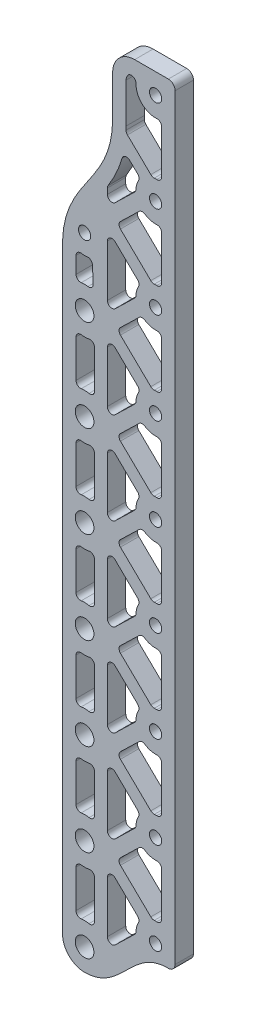
from build123d import *

# Parameters (mm, degrees)
SKETCH2_R                 = 1.625
SKETCH2_R_2               = 1.1
BOSS_EXTRUDE2_DEPTH       = 3
FILLET2_R                 = 3.5
CUT_EXTRUDE5_DEPTH        = 96.681621426
CUT_EXTRUDE5_DEPTH_BACK   = 96.681621426
FILLET7_R                 = 0.75
FILLET8_R                 = 1
FILLET9_R                 = 1
FILLET10_R                = 1
CUT_EXTRUDE8_DEPTH        = 96.681621426
BOSS_EXTRUDE3_START       = -3
BOSS_EXTRUDE3_OUTLINE_R   = 1.1
BOSS_EXTRUDE3_OUTLINE_R_2 = 1
BOSS_EXTRUDE3_OUTLINE_R_3 = 1.625
BOSS_EXTRUDE3_OUTLINE_R_4 = 1.525
BOSS_EXTRUDE3_DEPTH       = 3


# Read off the part's stored shape, not the designer's step: Boss-Extrude3
# Some blends are built 0.0001 mm under size
with BuildPart() as part:
    # Sketch2 → Boss-Extrude2 (new body)
    with BuildSketch(Plane.XY):
        with BuildLine():
            Line((-3.5, 62.5), (-3.5, -38.5))
            Line((-3.5, -38.5), (0, -38.5))
            add(Edge.make_bspline(
                [(0, -38.5), (6, -38.5), (7.5625, -31.1), (13.5625, -31.1)],
                knots=[0, 0, 0, 0, 1, 1, 1, 1], degree=3))
            Line((13.5625, -31.1), (14.125, -31.1))
            Line((14.125, -31.1), (14.125, -31.099203673))
            Line((14.125, -31.099203673), (14.6875, -31.099203673))
            Line((14.6875, -31.099203673), (14.6875, 94.5))
            Line((14.6875, 94.5), (4.6875, 94.5))
            Line((4.6875, 94.5), (4.6875, 84.5))
            add(Edge.make_bspline(
                [(-3.5, 62.5), (-3.5, 72.5), (4.6875, 74.5), (4.6875, 84.5)],
                knots=[0, 0, 0, 0, 1, 1, 1, 1], degree=3))
        make_face()
        with Locations((0, -35)):
            Circle(SKETCH2_R, mode=Mode.SUBTRACT)
        with Locations((0, -20)):
            Circle(SKETCH2_R, mode=Mode.SUBTRACT)
        with Locations((0, -5)):
            Circle(SKETCH2_R, mode=Mode.SUBTRACT)
        with Locations((0, 10)):
            Circle(SKETCH2_R, mode=Mode.SUBTRACT)
        with Locations((0, 25)):
            Circle(SKETCH2_R, mode=Mode.SUBTRACT)
        with Locations((11.6, -28.75)):
            Circle(SKETCH2_R_2, mode=Mode.SUBTRACT)
        with Locations((11.6, -13.75)):
            Circle(SKETCH2_R_2, mode=Mode.SUBTRACT)
        with Locations((11.6, 1.25)):
            Circle(SKETCH2_R_2, mode=Mode.SUBTRACT)
        with Locations((11.6, 16.25)):
            Circle(SKETCH2_R_2, mode=Mode.SUBTRACT)
        with Locations((0, 40)):
            Circle(SKETCH2_R, mode=Mode.SUBTRACT)
        with Locations((0, 55)):
            Circle(SKETCH2_R, mode=Mode.SUBTRACT)
        with Locations((0, 66)):
            Circle(SKETCH2_R_2, mode=Mode.SUBTRACT)
        with Locations((11.6, 31.25)):
            Circle(SKETCH2_R_2, mode=Mode.SUBTRACT)
        with Locations((11.6, 46.25)):
            Circle(SKETCH2_R_2, mode=Mode.SUBTRACT)
        with Locations((11.6, 61.25)):
            Circle(SKETCH2_R_2, mode=Mode.SUBTRACT)
        with Locations((11.6, 76.25)):
            Circle(SKETCH2_R_2, mode=Mode.SUBTRACT)
        with Locations((11.6, 91.25)):
            Circle(SKETCH2_R_2, mode=Mode.SUBTRACT)
    extrude(amount=BOSS_EXTRUDE2_DEPTH)

    # Fillet2
    fillet2_edges = [part.edges().sort_by_distance(p)[0] for p in [
        (4.6875, 94.5, 1.5),
        (-3.5, -38.5, 1.5),
    ]]
    fillet(fillet2_edges, radius=FILLET2_R - 0.0001)  # a hair under: the kernel refuses the full size

    # Sketch11 → Cut-Extrude5 (cut, two sides: drawn at the far end of the back side and taken through both)
    with BuildSketch(Plane.XY.offset(3).offset(-CUT_EXTRUDE5_DEPTH_BACK)):
        with BuildLine():
            Line((3.725, -33.468053879), (8.405154507, -28.931555164))
            ThreePointArc((8.405154507, -28.931555164), (8.552405464, -27.774209272), (9.104752078, -26.746568491))
            Line((9.104752078, -26.746568491), (3.725, -21.531946121))
            Line((3.725, -21.531946121), (3.725, -33.468053879))
        make_face()
        with BuildLine():
            ThreePointArc((11.075803274, -25.59322668), (11.838436702, -25.558895499), (12.5875, -25.706179416))
            Line((12.5875, -25.706179416), (12.5875, -16.793820584))
            ThreePointArc((12.5875, -16.793820584), (10.87997204, -16.867941586), (9.377845109, -16.05261322))
            Line((9.377845109, -16.05261322), (5.305457748, -20))
            Line((5.305457748, -20), (11.075803274, -25.59322668))
        make_face()
        with BuildLine():
            Line((-1.4, -23.45190165), (-1.4, -31.54809835))
            ThreePointArc((-1.4, -31.54809835), (0.123118135, -31.277035197), (1.625, -31.648134848))
            Line((1.625, -31.648134848), (1.625, -23.351865152))
            ThreePointArc((1.625, -23.351865152), (0.123118135, -23.722964803), (-1.4, -23.45190165))
        make_face()
        with BuildLine():
            Line((3.725, -18.468053879), (8.405154507, -13.931555164))
            ThreePointArc((8.405154507, -13.931555164), (8.552405464, -12.774209272), (9.104752078, -11.746568491))
            Line((9.104752078, -11.746568491), (3.725, -6.531946121))
            Line((3.725, -6.531946121), (3.725, -18.468053879))
        make_face()
        with BuildLine():
            Line((-1.4, -8.45190165), (-1.4, -16.54809835))
            ThreePointArc((-1.4, -16.54809835), (0.123118135, -16.277035197), (1.625, -16.648134848))
            Line((1.625, -16.648134848), (1.625, -8.351865152))
            ThreePointArc((1.625, -8.351865152), (0.123118135, -8.722964803), (-1.4, -8.45190165))
        make_face()
        with BuildLine():
            ThreePointArc((11.075803274, -10.59322668), (11.838436702, -10.558895499), (12.5875, -10.706179416))
            Line((12.5875, -10.706179416), (12.5875, -1.793820584))
            ThreePointArc((12.5875, -1.793820584), (10.87997204, -1.867941586), (9.377845109, -1.05261322))
            Line((9.377845109, -1.05261322), (5.305457748, -5))
            Line((5.305457748, -5), (11.075803274, -10.59322668))
        make_face()
        with BuildLine():
            Line((-1.4, 6.54809835), (-1.4, -1.54809835))
            ThreePointArc((-1.4, -1.54809835), (0.123118135, -1.277035197), (1.625, -1.648134848))
            Line((1.625, -1.648134848), (1.625, 6.648134848))
            ThreePointArc((1.625, 6.648134848), (0.123118135, 6.277035197), (-1.4, 6.54809835))
        make_face()
        with BuildLine():
            ThreePointArc((11.075803274, 4.40677332), (11.838436702, 4.441104501), (12.5875, 4.293820584))
            Line((12.5875, 4.293820584), (12.5875, 13.206179416))
            ThreePointArc((12.5875, 13.206179416), (10.87997204, 13.132058414), (9.377845109, 13.94738678))
            Line((9.377845109, 13.94738678), (5.305457748, 10))
            Line((5.305457748, 10), (11.075803274, 4.40677332))
        make_face()
        with BuildLine():
            Line((3.725, 8.468053879), (3.725, -3.468053879))
            Line((3.725, -3.468053879), (8.405154507, 1.068444836))
            ThreePointArc((8.405154507, 1.068444836), (8.552405464, 2.225790728), (9.104752078, 3.253431509))
            Line((9.104752078, 3.253431509), (3.725, 8.468053879))
        make_face()
        with BuildLine():
            Line((-1.4, 21.54809835), (-1.4, 13.45190165))
            ThreePointArc((-1.4, 13.45190165), (0.123118135, 13.722964803), (1.625, 13.351865152))
            Line((1.625, 13.351865152), (1.625, 21.648134848))
            ThreePointArc((1.625, 21.648134848), (0.123118135, 21.277035197), (-1.4, 21.54809835))
        make_face()
        with BuildLine():
            ThreePointArc((11.075803274, 19.40677332), (11.838436702, 19.441104501), (12.5875, 19.293820584))
            Line((12.5875, 19.293820584), (12.5875, 28.206179416))
            ThreePointArc((12.5875, 28.206179416), (10.87997204, 28.132058414), (9.377845109, 28.94738678))
            Line((9.377845109, 28.94738678), (5.305457748, 25))
            Line((5.305457748, 25), (11.075803274, 19.40677332))
        make_face()
        with BuildLine():
            Line((3.725, 11.531946121), (8.405154507, 16.068444836))
            ThreePointArc((8.405154507, 16.068444836), (8.552405464, 17.225790728), (9.104752078, 18.253431509))
            Line((9.104752078, 18.253431509), (3.725, 23.468053879))
            Line((3.725, 23.468053879), (3.725, 11.531946121))
        make_face()
        with BuildLine():
            Line((-1.4, 36.54809835), (-1.4, 28.45190165))
            ThreePointArc((-1.4, 28.45190165), (0.123118135, 28.722964803), (1.625, 28.351865152))
            Line((1.625, 28.351865152), (1.625, 36.648134848))
            ThreePointArc((1.625, 36.648134848), (0.123118135, 36.277035197), (-1.4, 36.54809835))
        make_face()
        with BuildLine():
            ThreePointArc((11.075803274, 34.40677332), (11.838436702, 34.441104501), (12.5875, 34.293820584))
            Line((12.5875, 34.293820584), (12.5875, 43.206179416))
            ThreePointArc((12.5875, 43.206179416), (10.87997204, 43.132058414), (9.377845109, 43.94738678))
            Line((9.377845109, 43.94738678), (5.305457748, 40))
            Line((5.305457748, 40), (11.075803274, 34.40677332))
        make_face()
        with BuildLine():
            Line((3.725, 26.531946121), (8.405154507, 31.068444836))
            ThreePointArc((8.405154507, 31.068444836), (8.552405464, 32.225790728), (9.104752078, 33.253431509))
            Line((9.104752078, 33.253431509), (3.725, 38.468053879))
            Line((3.725, 38.468053879), (3.725, 26.531946121))
        make_face()
        with BuildLine():
            Line((-1.4, 51.54809835), (-1.4, 43.45190165))
            ThreePointArc((-1.4, 43.45190165), (0.123118135, 43.722964803), (1.625, 43.351865152))
            Line((1.625, 43.351865152), (1.625, 51.648134848))
            ThreePointArc((1.625, 51.648134848), (0.123118135, 51.277035197), (-1.4, 51.54809835))
        make_face()
        with BuildLine():
            ThreePointArc((11.075803274, 49.40677332), (11.838436702, 49.441104501), (12.5875, 49.293820584))
            Line((12.5875, 49.293820584), (12.5875, 58.206179416))
            ThreePointArc((12.5875, 58.206179416), (10.87997204, 58.132058414), (9.377845109, 58.94738678))
            Line((9.377845109, 58.94738678), (5.305457748, 55))
            Line((5.305457748, 55), (11.075803274, 49.40677332))
        make_face()
        with BuildLine():
            Line((3.725, 41.531946121), (8.405154507, 46.068444836))
            ThreePointArc((8.405154507, 46.068444836), (8.552405464, 47.225790728), (9.104752078, 48.253431509))
            Line((9.104752078, 48.253431509), (3.725, 53.468053879))
            Line((3.725, 53.468053879), (3.725, 41.531946121))
        make_face()
        with BuildLine():
            Line((-1.4, 62.5), (-1.4, 58.45190165))
            ThreePointArc((-1.4, 58.45190165), (0.034214253, 58.724842867), (1.463172775, 58.4256022))
            Line((1.463172775, 58.4256022), (1.242166701, 63.05092864))
            ThreePointArc((1.242166701, 63.05092864), (-0.079937947, 62.800998605), (-1.387909616, 63.116650056))
            add(Edge.make_bspline(
                [(-1.387909616, 63.116650056), (-1.395884035, 62.912888667), (-1.4, 62.704817034), (-1.4, 62.5)],
                knots=[0.976163712, 0.976163712, 0.976163712, 0.976163712, 1, 1, 1, 1], degree=3))
        make_face()
        with BuildLine():
            ThreePointArc((11.075803274, 64.40677332), (11.838436702, 64.441104501), (12.5875, 64.293820584))
            Line((12.5875, 64.293820584), (12.5875, 73.206179416))
            ThreePointArc((12.5875, 73.206179416), (10.87997204, 73.132058414), (9.377845109, 73.94738678))
            Line((9.377845109, 73.94738678), (5.305457748, 70))
            Line((5.305457748, 70), (11.075803274, 64.40677332))
        make_face()
        with BuildLine():
            Line((3.725, 56.531946121), (8.405154507, 61.068444836))
            ThreePointArc((8.405154507, 61.068444836), (8.552405464, 62.225790728), (9.104752078, 63.253431509))
            Line((9.104752078, 63.253431509), (3.725, 68.468053879))
            Line((3.725, 68.468053879), (3.725, 56.531946121))
        make_face()
        with BuildLine():
            ThreePointArc((11.075803274, 79.40677332), (11.838436702, 79.441104501), (12.5875, 79.293820584))
            Line((12.5875, 79.293820584), (12.5875, 88.206179416))
            ThreePointArc((12.5875, 88.206179416), (9.277124298, 89.04903465), (8.613781656, 92.4))
            Line((8.613781656, 92.4), (8.1875, 92.4))
            ThreePointArc((8.1875, 92.4), (7.197550506, 91.989949494), (6.7875, 91))
            Line((6.7875, 91), (6.7875, 84.5))
            add(Edge.make_bspline(
                [(6.7875, 84.5), (6.7875, 84.194951753), (6.780380262, 83.886036866), (6.766439869, 83.583862242)],
                knots=[0, 0, 0, 0, 0.027924099, 0.027924099, 0.027924099, 0.027924099], degree=3))
            Line((6.766439869, 83.583862242), (11.075803274, 79.40677332))
        make_face()
        with BuildLine():
            Line((3.725, 71.531946121), (8.405154507, 76.068444836))
            ThreePointArc((8.405154507, 76.068444836), (8.552405464, 77.225790728), (9.104752078, 78.253431509))
            Line((9.104752078, 78.253431509), (6.429638417, 80.846433442))
            add(Edge.make_bspline(
                [(6.429638417, 80.846433442), (6.416072101, 80.780043671), (6.27732761, 80.121430007), (5.948536697, 78.931514317), (5.147093837, 76.868639651), (4.349164485, 75.426872946), (3.778979133, 74.508236606), (3.725, 74.422123209)],
                knots=[0.118031375, 0.118031375, 0.118031375, 0.118031375, 0.125, 0.1875, 0.25, 0.375, 0.388032458, 0.388032458, 0.388032458, 0.388032458], degree=3))
            Line((3.725, 74.422123209), (3.725, 71.531946121))
        make_face()
    extrude(amount=CUT_EXTRUDE5_DEPTH + CUT_EXTRUDE5_DEPTH_BACK, mode=Mode.SUBTRACT)

    # Fillet7
    fillet7_edges = [part.edges().sort_by_distance(p)[0] for p in [
        (12.5875, -1.793820584, 1.5),
        (12.5875, 4.293820584, 1.5),
        (12.5875, -10.706179416, 1.5),
        (12.5875, -16.793820584, 1.5),
        (11.075803274, -10.59322668, 1.5),
        (5.305457748, -5, 1.5),
        (9.377845109, -1.05261322, 1.5),
        (8.405154507, 1.068444836, 1.5),
        (3.725, -3.468053879, 1.5),
        (3.725, 8.468053879, 1.5),
        (9.104752078, 3.253431509, 1.5),
        (1.242166701, 63.05092864, 1.5),
        (1.463172775, 58.4256022, 1.5),
        (-1.4, 58.45190165, 1.5),
        (-1.4, 51.54809835, 1.5),
        (-1.387909616, 63.116650056, 1.5),
        (12.5875, 58.206179416, 1.5),
        (12.5875, 64.293820584, 1.5),
        (12.5875, 49.293820584, 1.5),
        (12.5875, 43.206179416, 1.5),
        (11.075803274, 49.40677332, 1.5),
        (5.305457748, 55, 1.5),
        (9.377845109, 58.94738678, 1.5),
        (8.405154507, 31.068444836, 1.5),
        (3.725, 26.531946121, 1.5),
        (3.725, 38.468053879, 1.5),
        (9.104752078, 33.253431509, 1.5),
        (-1.4, 36.54809835, 1.5),
        (-1.4, 43.45190165, 1.5),
        (1.625, 51.648134848, 1.5),
        (1.625, 36.648134848, 1.5),
        (1.625, 43.351865152, 1.5),
        (8.405154507, 16.068444836, 1.5),
        (3.725, 11.531946121, 1.5),
        (3.725, 23.468053879, 1.5),
        (9.104752078, 18.253431509, 1.5),
        (-1.4, 6.54809835, 1.5),
        (-1.4, 13.45190165, 1.5),
        (-1.4, 28.45190165, 1.5),
        (-1.4, 21.54809835, 1.5),
        (1.625, 28.351865152, 1.5),
        (1.625, 21.648134848, 1.5),
        (1.625, 6.648134848, 1.5),
        (1.625, 13.351865152, 1.5),
        (-1.4, -31.54809835, 1.5),
        (-1.4, -16.54809835, 1.5),
        (-1.4, -23.45190165, 1.5),
        (9.104752078, 78.253431509, 1.5),
        (8.405154507, 76.068444836, 1.5),
        (3.725, 71.531946121, 1.5),
        (3.725, 74.422123209, 1.5),
        (6.429638417, 80.846433442, 1.5),
        (12.5875, -25.706179416, 1.5),
        (11.075803274, -25.59322668, 1.5),
        (5.305457748, -20, 1.5),
        (9.377845109, -16.05261322, 1.5),
        (8.405154507, 46.068444836, 1.5),
        (3.725, 41.531946121, 1.5),
        (3.725, 53.468053879, 1.5),
        (9.104752078, 48.253431509, 1.5),
        (8.613781656, 92.4, 1.5),
        (12.5875, 88.206179416, 1.5),
        (12.5875, 73.206179416, 1.5),
        (12.5875, 79.293820584, 1.5),
        (11.075803274, 79.40677332, 1.5),
        (6.766439869, 83.583862242, 1.5),
        (11.075803274, 64.40677332, 1.5),
        (5.305457748, 70, 1.5),
        (9.377845109, 73.94738678, 1.5),
        (8.405154507, -28.931555164, 1.5),
        (3.725, -33.468053879, 1.5),
        (3.725, -21.531946121, 1.5),
        (9.104752078, -26.746568491, 1.5),
        (12.5875, 34.293820584, 1.5),
        (12.5875, 28.206179416, 1.5),
        (12.5875, 13.206179416, 1.5),
        (12.5875, 19.293820584, 1.5),
        (11.075803274, 19.40677332, 1.5),
        (5.305457748, 25, 1.5),
        (9.377845109, 28.94738678, 1.5),
        (11.075803274, 4.40677332, 1.5),
        (5.305457748, 10, 1.5),
        (9.377845109, 13.94738678, 1.5),
        (11.075803274, 34.40677332, 1.5),
        (5.305457748, 40, 1.5),
        (9.377845109, 43.94738678, 1.5),
        (-1.4, -1.54809835, 1.5),
        (-1.4, -8.45190165, 1.5),
        (1.625, -1.648134848, 1.5),
        (1.625, -8.351865152, 1.5),
        (1.625, -16.648134848, 1.5),
        (1.625, -23.351865152, 1.5),
        (8.405154507, 61.068444836, 1.5),
        (3.725, 56.531946121, 1.5),
        (3.725, 68.468053879, 1.5),
        (9.104752078, 63.253431509, 1.5),
        (8.405154507, -13.931555164, 1.5),
        (3.725, -18.468053879, 1.5),
        (3.725, -6.531946121, 1.5),
        (9.104752078, -11.746568491, 1.5),
        (1.625, -31.648134848, 1.5),
    ]]
    fillet(fillet7_edges, radius=FILLET7_R)

    # Fillet8
    fillet8_edges = [part.edges().sort_by_distance(p)[0] for p in [
        (14.6875, 94.5, 1.5),
    ]]
    fillet(fillet8_edges, radius=FILLET8_R)

    # Fillet9
    # the kernel refuses this fillet: 1 mm, written as the material it takes off along each edge
    with BuildSketch(Plane(origin=(14.6875, -31.099203673, -2.248046027), x_dir=(0, 1, 0), z_dir=(0, 0, 1))) as fillet9_piece_1:
        with BuildLine():
            CenterArc((0.899218411, 1), FILLET9_R, 205.944479772, 64.055520228)
            Line((0, 0.5625), (-0.017984368, 0.55375))
            ThreePointArc((-0.017984368, 0.55375), (-0.02, 0.28125), (-0.02, 0))
            Line((-0.02, 0), (0, -0.02))
            Line((0, -0.02), (0.899218411, -0.02))
            Line((0.899218411, -0.02), (0.899218411, 0))
        make_face()
    extrude(amount=7.496092053, mode=Mode.SUBTRACT)

    # Fillet10
    # the kernel refuses this fillet: 1 mm, written as the material it takes off along each edge
    with BuildSketch(Plane(origin=(14.125, -31.1, -0.099750315), x_dir=(0, 1, 0), z_dir=(0, 0, 1))) as fillet10_piece_1:
        with BuildLine():
            CenterArc((1, 0.039900126), FILLET10_R, 180, 2.28671585)
            Line((0, 0.039900126), (0, 0))
            Line((0, 0), (0.000796327, 0))
        make_face()
    extrude(amount=3.19950063, mode=Mode.SUBTRACT)

    # Sketch16 → Cut-Extrude8 (cut, through all)
    with BuildSketch(Plane.XY.offset(3)):
        with BuildLine():
            ThreePointArc((14.6875, -30.1), (14.394606781, -30.807106781), (13.6875, -31.1))
            Line((13.6875, -31.1), (14.085099874, -31.1))
            ThreePointArc((14.085099874, -31.1), (14.10505391, -31.099800898), (14.125, -31.099203673))
            ThreePointArc((14.125, -31.099203673), (14.535291248, -30.730315348), (14.6875, -30.199985262))
            Line((14.6875, -30.199985262), (14.6875, -30.1))
        make_face()
    extrude(amount=-CUT_EXTRUDE8_DEPTH, mode=Mode.SUBTRACT)

    # Boss-Extrude3 outline → Boss-Extrude3 (add)
    # profile 1 of 18: a face of its own
    with BuildSketch(Plane.XY.offset(3).offset(BOSS_EXTRUDE3_START)):
        with BuildLine():
            ThreePointArc((-3.6, -35), (-2.545584412, -37.545584412), (0, -38.6))
            add(Edge.make_bspline(
                [(0, -38.6), (0.364683413, -38.6), (1.11305104, -38.541373891), (2.431737545, -38.218454304), (3.898576823, -37.485372126), (5.430598987, -36.261303595), (6.852327606, -34.870309825), (8.267222195, -33.486303595), (9.775716803, -32.282247126), (11.20303535, -31.570016804), (12.480829962, -31.256998891), (13.208268844, -31.2), (13.5625, -31.2)],
                knots=[0, 0, 0, 0, 0.0625, 0.125, 0.25, 0.375, 0.5, 0.625, 0.75, 0.875, 0.9375, 1, 1, 1, 1], degree=3))
            Line((13.5625, -31.2), (13.6875, -31.2))
            ThreePointArc((13.6875, -31.2), (14.465317459, -30.877817459), (14.7875, -30.1))
            Line((14.7875, -30.1), (14.7875, 93.5))
            ThreePointArc((14.7875, 93.5), (14.465317459, 94.277817459), (13.6875, 94.6))
            Line((13.6875, 94.6), (8.1875, 94.6))
            ThreePointArc((8.1875, 94.6), (5.641915588, 93.545584412), (4.5875, 91))
            Line((4.5875, 91), (4.5875, 84.5))
            add(Edge.make_bspline(
                [(4.5875, 84.5), (4.5875, 84.196784), (4.571596515, 83.579879679), (4.480204094, 82.432247843), (4.261775409, 81.090953896), (3.856826564, 79.625468439), (3.157871834, 77.824602038), (2.044395135, 75.803754263), (0.512098769, 73.557679353), (-1.025917365, 71.303690601), (-2.151210198, 69.262303634), (-2.85948203, 67.437618299), (-3.270084943, 65.951665793), (-3.491414558, 64.592368618), (-3.583921063, 63.430457404), (-3.6, 62.806685549), (-3.6, 62.5)],
                knots=[0, 0, 0, 0, 0.03125, 0.0625, 0.125, 0.1875, 0.25, 0.375, 0.5, 0.625, 0.75, 0.8125, 0.875, 0.9375, 0.96875, 1, 1, 1, 1], degree=3))
            Line((-3.6, 62.5), (-3.6, -35))
        make_face()
        with BuildLine():
            add(Edge.make_bspline(
                [(0, -38.5), (6, -38.5), (7.5625, -31.1), (13.5625, -31.1)],
                knots=[0, 0, 0, 0, 1, 1, 1, 1], degree=3))
            ThreePointArc((0, -38.5), (-2.474873734, -37.474873734), (-3.5, -35))
            Line((-3.5, -35), (-3.5, 62.5))
            add(Edge.make_bspline(
                [(-3.5, 62.5), (-3.5, 72.5), (4.6875, 74.5), (4.6875, 84.5)],
                knots=[0, 0, 0, 0, 1, 1, 1, 1], degree=3))
            Line((4.6875, 84.5), (4.6875, 91))
            ThreePointArc((4.6875, 91), (5.712626266, 93.474873734), (8.1875, 94.5))
            Line((8.1875, 94.5), (13.6875, 94.5))
            ThreePointArc((13.6875, 94.5), (14.394606781, 94.207106781), (14.6875, 93.5))
            Line((14.6875, 93.5), (14.6875, -30.1))
            ThreePointArc((14.6875, -30.1), (14.394606781, -30.807106781), (13.6875, -31.1))
            Line((13.6875, -31.1), (13.5625, -31.1))
        make_face(mode=Mode.SUBTRACT)
    # profile 2 of 18: a face of its own
    with BuildSketch(Plane.XY.offset(3).offset(BOSS_EXTRUDE3_START)):
        with Locations((11.6, 76.25)):
            Circle(BOSS_EXTRUDE3_OUTLINE_R)
        with Locations((11.6, 76.25)):
            Circle(BOSS_EXTRUDE3_OUTLINE_R_2, mode=Mode.SUBTRACT)
    # profile 3 of 18: a face of its own
    with BuildSketch(Plane.XY.offset(3).offset(BOSS_EXTRUDE3_START)):
        with Locations((11.6, 91.25)):
            Circle(BOSS_EXTRUDE3_OUTLINE_R)
        with Locations((11.6, 91.25)):
            Circle(BOSS_EXTRUDE3_OUTLINE_R_2, mode=Mode.SUBTRACT)
    # profile 4 of 18: a face of its own
    with BuildSketch(Plane.XY.offset(3).offset(BOSS_EXTRUDE3_START)):
        with Locations((0, -35)):
            Circle(BOSS_EXTRUDE3_OUTLINE_R_3)
        with Locations((0, -35)):
            Circle(BOSS_EXTRUDE3_OUTLINE_R_4, mode=Mode.SUBTRACT)
    # profile 5 of 18: a face of its own
    with BuildSketch(Plane.XY.offset(3).offset(BOSS_EXTRUDE3_START)):
        with Locations((0, -20)):
            Circle(BOSS_EXTRUDE3_OUTLINE_R_3)
        with Locations((0, -20)):
            Circle(BOSS_EXTRUDE3_OUTLINE_R_4, mode=Mode.SUBTRACT)
    # profile 6 of 18: a face of its own
    with BuildSketch(Plane.XY.offset(3).offset(BOSS_EXTRUDE3_START)):
        with Locations((0, -5)):
            Circle(BOSS_EXTRUDE3_OUTLINE_R_3)
        with Locations((0, -5)):
            Circle(BOSS_EXTRUDE3_OUTLINE_R_4, mode=Mode.SUBTRACT)
    # profile 7 of 18: a face of its own
    with BuildSketch(Plane.XY.offset(3).offset(BOSS_EXTRUDE3_START)):
        with Locations((0, 10)):
            Circle(BOSS_EXTRUDE3_OUTLINE_R_3)
        with Locations((0, 10)):
            Circle(BOSS_EXTRUDE3_OUTLINE_R_4, mode=Mode.SUBTRACT)
    # profile 8 of 18: a face of its own
    with BuildSketch(Plane.XY.offset(3).offset(BOSS_EXTRUDE3_START)):
        with Locations((0, 25)):
            Circle(BOSS_EXTRUDE3_OUTLINE_R_3)
        with Locations((0, 25)):
            Circle(BOSS_EXTRUDE3_OUTLINE_R_4, mode=Mode.SUBTRACT)
    # profile 9 of 18: a face of its own
    with BuildSketch(Plane.XY.offset(3).offset(BOSS_EXTRUDE3_START)):
        with Locations((0, 40)):
            Circle(BOSS_EXTRUDE3_OUTLINE_R_3)
        with Locations((0, 40)):
            Circle(BOSS_EXTRUDE3_OUTLINE_R_4, mode=Mode.SUBTRACT)
    # profile 10 of 18: a face of its own
    with BuildSketch(Plane.XY.offset(3).offset(BOSS_EXTRUDE3_START)):
        with Locations((0, 55)):
            Circle(BOSS_EXTRUDE3_OUTLINE_R_3)
        with Locations((0, 55)):
            Circle(BOSS_EXTRUDE3_OUTLINE_R_4, mode=Mode.SUBTRACT)
    # profile 11 of 18: a face of its own
    with BuildSketch(Plane.XY.offset(3).offset(BOSS_EXTRUDE3_START)):
        with Locations((11.6, 61.25)):
            Circle(BOSS_EXTRUDE3_OUTLINE_R)
        with Locations((11.6, 61.25)):
            Circle(BOSS_EXTRUDE3_OUTLINE_R_2, mode=Mode.SUBTRACT)
    # profile 12 of 18: a face of its own
    with BuildSketch(Plane.XY.offset(3).offset(BOSS_EXTRUDE3_START)):
        with Locations((11.6, 46.25)):
            Circle(BOSS_EXTRUDE3_OUTLINE_R)
        with Locations((11.6, 46.25)):
            Circle(BOSS_EXTRUDE3_OUTLINE_R_2, mode=Mode.SUBTRACT)
    # profile 13 of 18: a face of its own
    with BuildSketch(Plane.XY.offset(3).offset(BOSS_EXTRUDE3_START)):
        with Locations((11.6, 31.25)):
            Circle(BOSS_EXTRUDE3_OUTLINE_R)
        with Locations((11.6, 31.25)):
            Circle(BOSS_EXTRUDE3_OUTLINE_R_2, mode=Mode.SUBTRACT)
    # profile 14 of 18: a face of its own
    with BuildSketch(Plane.XY.offset(3).offset(BOSS_EXTRUDE3_START)):
        with Locations((11.6, 16.25)):
            Circle(BOSS_EXTRUDE3_OUTLINE_R)
        with Locations((11.6, 16.25)):
            Circle(BOSS_EXTRUDE3_OUTLINE_R_2, mode=Mode.SUBTRACT)
    # profile 15 of 18: a face of its own
    with BuildSketch(Plane.XY.offset(3).offset(BOSS_EXTRUDE3_START)):
        with Locations((11.6, 1.25)):
            Circle(BOSS_EXTRUDE3_OUTLINE_R)
        with Locations((11.6, 1.25)):
            Circle(BOSS_EXTRUDE3_OUTLINE_R_2, mode=Mode.SUBTRACT)
    # profile 16 of 18: a face of its own
    with BuildSketch(Plane.XY.offset(3).offset(BOSS_EXTRUDE3_START)):
        with Locations((11.6, -13.75)):
            Circle(BOSS_EXTRUDE3_OUTLINE_R)
        with Locations((11.6, -13.75)):
            Circle(BOSS_EXTRUDE3_OUTLINE_R_2, mode=Mode.SUBTRACT)
    # profile 17 of 18: a face of its own
    with BuildSketch(Plane.XY.offset(3).offset(BOSS_EXTRUDE3_START)):
        with Locations((11.6, -28.75)):
            Circle(BOSS_EXTRUDE3_OUTLINE_R)
        with Locations((11.6, -28.75)):
            Circle(BOSS_EXTRUDE3_OUTLINE_R_2, mode=Mode.SUBTRACT)
    # profile 18 of 18: a face of its own
    with BuildSketch(Plane.XY.offset(3).offset(BOSS_EXTRUDE3_START)):
        with Locations((0, 66)):
            Circle(BOSS_EXTRUDE3_OUTLINE_R)
        with Locations((0, 66)):
            Circle(BOSS_EXTRUDE3_OUTLINE_R_2, mode=Mode.SUBTRACT)
    extrude(amount=BOSS_EXTRUDE3_DEPTH)


solid = part.part
